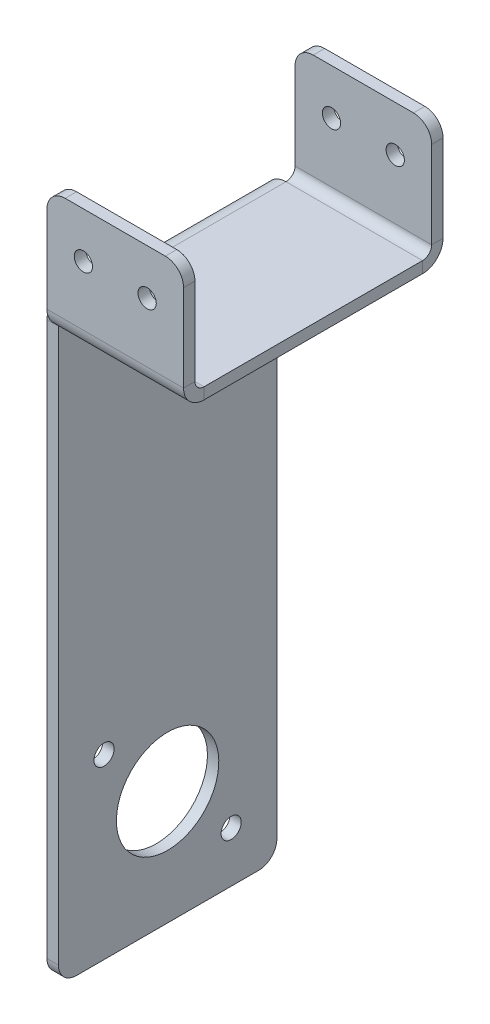
from build123d import *

# Parameters (mm, degrees)
SKETCH1_W               = 38.1
SKETCH1_H               = 60.96
BASE_FLANGE1_DEPTH      = 3.175
EDGE_FLANGE1_DEPTH      = 38.1
EDGE_FLANGE1_BEND_DEPTH = 38.1
EDGE_FLANGE2_DEPTH      = 60.96
SKETCH17_R              = 14.28115
SKETCH17_R_2            = 2.8067
CUT_EXTRUDE1_DEPTH      = 175.607680959
SKETCH18_R              = 2.5527
CUT_EXTRUDE2_DEPTH      = 182.96600596
FILLET1_R               = 5.08


# Sheet-metal steps are written as plain solids
with BuildPart() as part:
    # Sketch1 → Base-Flange1 (new body)
    with BuildSketch(Plane(origin=(0, 0, 0), x_dir=(1, 0, 0), z_dir=(0, 1, 0))):
        Rectangle(SKETCH1_W, SKETCH1_H)
    extrude(amount=-BASE_FLANGE1_DEPTH)

    # Edge-Flange1 section (across the edge) → Edge-Flange1 (add)
    with BuildSketch(Plane(origin=(-19.05, 0, 33.02), x_dir=(0, 0, -1), z_dir=(1, 0, 0))):
        with BuildLine():
            Line((-3.175, 2.54), (-3.175, 31.877))
            Line((-3.175, 31.877), (0, 31.877))
            Line((0, 31.877), (0, 2.54))
            ThreePointArc((0, 2.54), (0.743948776, 0.743948776), (2.54, 0))
            Line((2.54, 0), (2.54, -3.175))
            ThreePointArc((2.54, -3.175), (-1.501115254, -1.501115254), (-3.175, 2.54))
        make_face()
    extrude(amount=EDGE_FLANGE1_DEPTH)

    # Edge-Flange1 section 2 (across the edge) → Edge-Flange1 bend (add)
    with BuildSketch(Plane(origin=(19.05, 0, -33.02), x_dir=(0, 0, 1), z_dir=(-1, 0, 0))):
        with BuildLine():
            Line((-3.175, 2.54), (-3.175, 31.877))
            Line((-3.175, 31.877), (0, 31.877))
            Line((0, 31.877), (0, 2.54))
            ThreePointArc((0, 2.54), (0.743948776, 0.743948776), (2.54, 0))
            Line((2.54, 0), (2.54, -3.175))
            ThreePointArc((2.54, -3.175), (-1.501115254, -1.501115254), (-3.175, 2.54))
        make_face()
    extrude(amount=EDGE_FLANGE1_BEND_DEPTH)

    # Edge-Flange2 section (across the edge) → Edge-Flange2 (add)
    with BuildSketch(Plane(origin=(-21.59, -3.175, 30.48), x_dir=(1, 0, 0), z_dir=(0, 0, -1))):
        with BuildLine():
            Line((-3.175, 2.54), (-3.175, 161.925))
            Line((-3.175, 161.925), (0, 161.925))
            Line((0, 161.925), (0, 2.54))
            ThreePointArc((0, 2.54), (0.743948776, 0.743948776), (2.54, 0))
            Line((2.54, 0), (2.54, -3.175))
            ThreePointArc((2.54, -3.175), (-1.501115254, -1.501115254), (-3.175, 2.54))
        make_face()
    extrude(amount=EDGE_FLANGE2_DEPTH)

    # Sketch17 → Cut-Extrude1 (cut, through all)
    with BuildSketch(Plane.ZY.offset(24.765)):
        with Locations(Location((0, -133.2738, 0), (0, 0, 270))):
            Circle(SKETCH17_R)
        with Locations(Location((-17.7292, -151.003, 0), (0, 0, 270))):
            Circle(SKETCH17_R_2)
        with Locations(Location((17.7292, -115.5446, 0), (0, 0, 270))):
            Circle(SKETCH17_R_2)
    extrude(amount=-CUT_EXTRUDE1_DEPTH, mode=Mode.SUBTRACT)

    # Sketch18 → Cut-Extrude2 (cut, through all)
    with BuildSketch(Plane.XY.offset(36.195)):
        with Locations((8.89, 19.177)):
            Circle(SKETCH18_R)
        with Locations((-8.89, 19.177)):
            Circle(SKETCH18_R)
    extrude(amount=-CUT_EXTRUDE2_DEPTH, mode=Mode.SUBTRACT)

    # Fillet1
    fillet1_edges = [part.edges().sort_by_distance(p)[0] for p in [
        (-19.05, 31.877, 34.6075),
        (19.05, 31.877, 34.6075),
        (19.05, 31.877, -34.6075),
        (-19.05, 31.877, -34.6075),
        (-23.1775, -165.1, 30.48),
        (-23.1775, -165.1, -30.48),
    ]]
    fillet(fillet1_edges, radius=FILLET1_R)


solid = part.part
